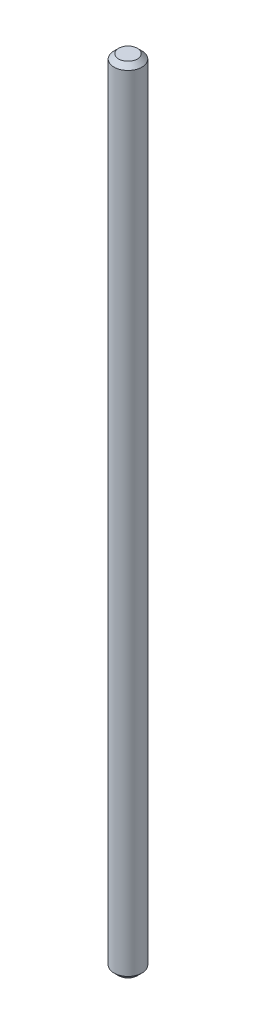
from build123d import *

# Parameters (mm, degrees)
SKETCH2_R           = 1.5
BOSS_EXTRUDE1_DEPTH = 85
CHAMFER1_SIZE       = 0.5


with BuildPart() as part:
    # Sketch2 → Boss-Extrude1 (new body)
    with BuildSketch(Plane(origin=(0, 0, 0), x_dir=(1, 0, 0), z_dir=(0, 1, 0))):
        Circle(SKETCH2_R)
    extrude(amount=BOSS_EXTRUDE1_DEPTH)

    # Chamfer1
    chamfer1_edges = [part.edges().sort_by_distance(p)[0] for p in [
        (-1.5, 85, 0),
        (-1.5, 0, 0),
    ]]
    chamfer(chamfer1_edges, length=CHAMFER1_SIZE)


solid = part.part
